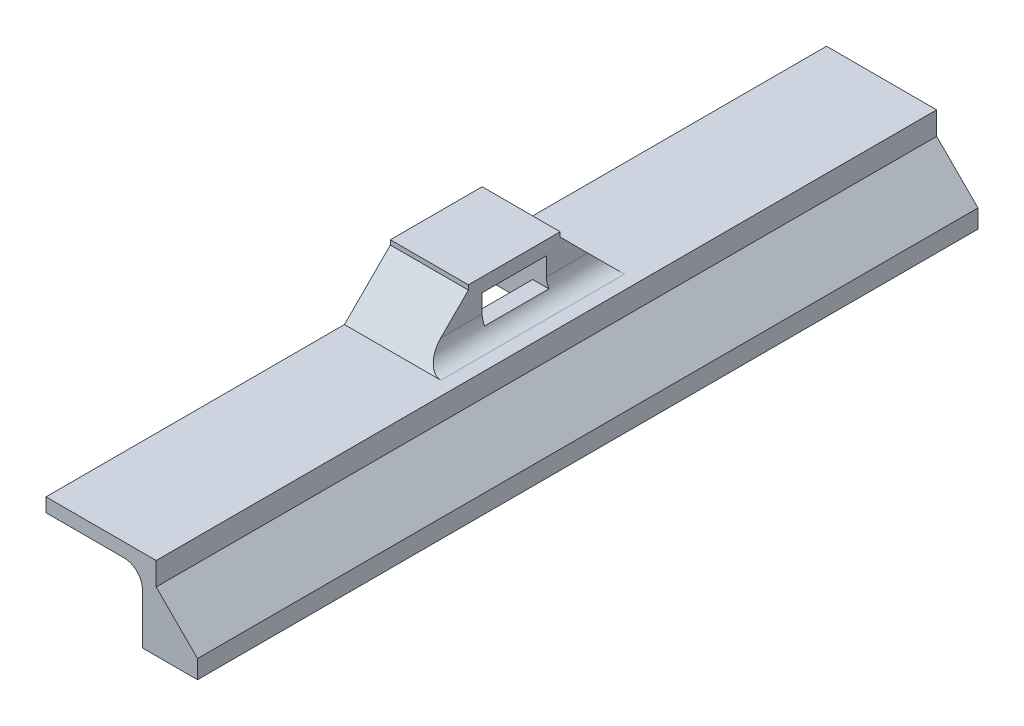
from build123d import *

# Parameters (mm, degrees)
SKETCH_1_W          = 6
SKETCH_1_H          = 85
EXTRUDE_1_DEPTH     = 1.5
SKETCH_2_W          = 1.5
SKETCH_2_H          = 85
EXTRUDE_2_DEPTH     = 6
EXTRUDE_3_DEPTH     = 1.5
SKETCH_4_W          = 7
SKETCH_4_H          = 7
EXTRUDE_4_DEPTH     = 5.5
SKETCH_5_W          = 7
SKETCH_5_H          = 7
CUT_EXTRUDE_1_DEPTH = 4
SKETCH_6_W          = 7
SKETCH_6_H          = 3
CUT_EXTRUDE_2_DEPTH = 4
CHAMFER_1_SIZE      = 5
CHAMFER_2_SIZE      = 5
FILLET_1_R          = 2
FILLET_2_R          = 2


with BuildPart() as part:
    # Эскиз1 → Бобышка-Вытянуть1 (new body)
    with BuildSketch(Plane(origin=(0, 0, 0), x_dir=(1, 0, 0), z_dir=(0, 1, 0))):
        Rectangle(SKETCH_1_W, SKETCH_1_H)
    extrude(amount=EXTRUDE_1_DEPTH)

    # Эскиз2 → Бобышка-Вытянуть2 (add)
    with BuildSketch(Plane(origin=(0, 1.5, 0), x_dir=(1, 0, 0), z_dir=(0, 1, 0))):
        with Locations((-2.25, 0)):
            Rectangle(SKETCH_2_W, SKETCH_2_H)
    extrude(amount=EXTRUDE_2_DEPTH)

    # Эскиз3 → Бобышка-Вытянуть3 (add)
    with BuildSketch(Plane(origin=(0, 7.5, 0), x_dir=(1, 0, 0), z_dir=(0, 1, 0))):
        Polygon((-1.5, -42.5), (-13.5, -42.5), (-13.5, -3.5), (-6.5, -3.5), (-6.5, 3.5), (-13.5, 3.5), (-13.5, 42.5), (-1.5, 42.5), align=None)
    extrude(amount=EXTRUDE_3_DEPTH)

    # Эскиз4 → Бобышка-Вытянуть4 (add)
    with BuildSketch(Plane(origin=(0, 9, 0), x_dir=(1, 0, 0), z_dir=(0, 1, 0))):
        Polygon((-13.5, -3.5), (-13.5, -5), (-5, -5), (-5, 5), (-13.5, 5), (-13.5, 3.5), (-6.5, 3.5), (-6.5, -3.5), align=None)
        with Locations((-10, 0)):
            Rectangle(SKETCH_4_W, SKETCH_4_H)
    extrude(amount=EXTRUDE_4_DEPTH)

    # Эскиз5 → Вырез-Вытянуть1 (cut)
    with BuildSketch(Plane.XZ.offset(-9)):
        with Locations((-10, 0)):
            Rectangle(SKETCH_5_W, SKETCH_5_H)
    extrude(amount=-CUT_EXTRUDE_1_DEPTH, mode=Mode.SUBTRACT)

    # Эскиз6 → Вырез-Вытянуть2 (cut)
    with BuildSketch(Plane(origin=(-5, 0, 0), x_dir=(0, 0, -1), z_dir=(1, 0, 0))):
        with Locations((0, 11.5)):
            Rectangle(SKETCH_6_W, SKETCH_6_H)
    extrude(amount=-CUT_EXTRUDE_2_DEPTH, mode=Mode.SUBTRACT)

    # Фаска1
    # the kernel refuses this chamfer: 5 mm, written as the material it adds along each edge
    with BuildSketch(Plane(origin=(-1.5, 1.5, 42.5), x_dir=(-0.02749587661058636, 0.9996219169112968, 0), z_dir=(0, 0, -1))) as chamfer_1_piece_1_section:
        Polygon((CHAMFER_1_SIZE * 0.999621916911, CHAMFER_1_SIZE * 0.0274958766106), (-CHAMFER_1_SIZE * 0.0274958766106, CHAMFER_1_SIZE * 0.999621916911), (0, 0), align=None)
    chamfer_1_piece_1 = extrude(amount=85, mode=Mode.PRIVATE)
    chamfer_1_piece_1 = split(chamfer_1_piece_1, bisect_by=Plane(origin=(3, 3.179503735, 0), z_dir=(-1, 0, 0)), keep=Keep.TOP, mode=Mode.PRIVATE)
    add(chamfer_1_piece_1)

    # Фаска2
    chamfer_2_edges = [part.edges().sort_by_distance(p)[0] for p in [
        (-9.25, 9, 5),
        (-9.25, 9, -5),
    ]]
    chamfer(chamfer_2_edges, length=CHAMFER_2_SIZE)

    # Скругление1
    # the kernel refuses this fillet: 2 mm, written as the material it adds along each edge
    with BuildSketch(Plane(origin=(-5, 9, -15), x_dir=(1, 0, 0), z_dir=(0, 0, 1))) as fillet_1_piece_1_section:
        with BuildLine():
            CenterArc((FILLET_1_R, FILLET_1_R), FILLET_1_R, 180, 90)
            Line((0, FILLET_1_R), (0, 0))
            Line((0, 0), (FILLET_1_R, 0))
        make_face()
    fillet_1_piece_1 = extrude(amount=30, mode=Mode.PRIVATE)
    fillet_1_piece_1 = split(fillet_1_piece_1, bisect_by=Plane(origin=(-4.478955551, 10.861954239, -8.138045761), z_dir=(0, -0.7071067811865476, 0.7071067811865475)), keep=Keep.TOP, mode=Mode.PRIVATE)
    fillet_1_piece_1 = split(fillet_1_piece_1, bisect_by=Plane(origin=(-4.478955551, 10, -6.592030507), z_dir=(0, -1, 0)), keep=Keep.TOP, mode=Mode.PRIVATE)
    fillet_1_piece_1 = split(fillet_1_piece_1, bisect_by=Plane(origin=(-4.478955551, 9.315938986, -3.5), z_dir=(0, 0, -1)), keep=Keep.TOP, mode=Mode.PRIVATE)
    add(fillet_1_piece_1)
    with BuildSketch(Plane(origin=(-5, 9, -15), x_dir=(1, 0, 0), z_dir=(0, 0, 1))) as fillet_1_piece_2_section:
        with BuildLine():
            CenterArc((FILLET_1_R, FILLET_1_R), FILLET_1_R, 180, 90)
            Line((0, FILLET_1_R), (0, 0))
            Line((0, 0), (FILLET_1_R, 0))
        make_face()
    fillet_1_piece_2 = extrude(amount=30, mode=Mode.PRIVATE)
    fillet_1_piece_2 = split(fillet_1_piece_2, bisect_by=Plane(origin=(-4.950049331, 11.610374757, -7.389625243), z_dir=(0, -0.7071067811865476, 0.7071067811865475)), keep=Keep.TOP, mode=Mode.PRIVATE)
    fillet_1_piece_2 = split(fillet_1_piece_2, bisect_by=Plane(origin=(-4.950049331, 10, -6.093083495), z_dir=(0, 1, 0)), keep=Keep.TOP, mode=Mode.PRIVATE)
    fillet_1_piece_2 = split(fillet_1_piece_2, bisect_by=Plane(origin=(-4.950049331, 10.313833009, -3.5), z_dir=(0, 0, -1)), keep=Keep.TOP, mode=Mode.PRIVATE)
    add(fillet_1_piece_2)
    with BuildSketch(Plane(origin=(-5, 9, -15), x_dir=(1, 0, 0), z_dir=(0, 0, 1))) as fillet_1_piece_3_section:
        with BuildLine():
            CenterArc((FILLET_1_R, FILLET_1_R), FILLET_1_R, 180, 90)
            Line((0, FILLET_1_R), (0, 0))
            Line((0, 0), (FILLET_1_R, 0))
        make_face()
    fillet_1_piece_3 = extrude(amount=30, mode=Mode.PRIVATE)
    fillet_1_piece_3 = split(fillet_1_piece_3, bisect_by=Plane(origin=(-4.48975988, 9.328783529, 3.5), z_dir=(0, 0, -1)), keep=Keep.TOP, mode=Mode.PRIVATE)
    fillet_1_piece_3 = split(fillet_1_piece_3, bisect_by=Plane(origin=(-4.48975988, 10, 0), z_dir=(0, -1, 0)), keep=Keep.TOP, mode=Mode.PRIVATE)
    fillet_1_piece_3 = split(fillet_1_piece_3, bisect_by=Plane(origin=(-4.48975988, 9.328783529, -3.5), z_dir=(0, 0, 1)), keep=Keep.TOP, mode=Mode.PRIVATE)
    add(fillet_1_piece_3)
    with BuildSketch(Plane(origin=(-5, 9, -15), x_dir=(1, 0, 0), z_dir=(0, 0, 1))) as fillet_1_piece_4_section:
        with BuildLine():
            CenterArc((FILLET_1_R, FILLET_1_R), FILLET_1_R, 180, 90)
            Line((0, FILLET_1_R), (0, 0))
            Line((0, 0), (FILLET_1_R, 0))
        make_face()
    fillet_1_piece_4 = extrude(amount=30, mode=Mode.PRIVATE)
    fillet_1_piece_4 = split(fillet_1_piece_4, bisect_by=Plane(origin=(-4.478955551, 10.861954239, 8.138045761), z_dir=(0, -0.7071067811865475, -0.7071067811865476)), keep=Keep.TOP, mode=Mode.PRIVATE)
    fillet_1_piece_4 = split(fillet_1_piece_4, bisect_by=Plane(origin=(-4.478955551, 9.315938986, 3.5), z_dir=(0, 0, 1)), keep=Keep.TOP, mode=Mode.PRIVATE)
    fillet_1_piece_4 = split(fillet_1_piece_4, bisect_by=Plane(origin=(-4.478955551, 10, 6.592030507), z_dir=(0, -1, 0)), keep=Keep.TOP, mode=Mode.PRIVATE)
    add(fillet_1_piece_4)
    with BuildSketch(Plane(origin=(-5, 9, -15), x_dir=(1, 0, 0), z_dir=(0, 0, 1))) as fillet_1_piece_5_section:
        with BuildLine():
            CenterArc((FILLET_1_R, FILLET_1_R), FILLET_1_R, 180, 90)
            Line((0, FILLET_1_R), (0, 0))
            Line((0, 0), (FILLET_1_R, 0))
        make_face()
    fillet_1_piece_5 = extrude(amount=30, mode=Mode.PRIVATE)
    fillet_1_piece_5 = split(fillet_1_piece_5, bisect_by=Plane(origin=(-4.950049331, 11.610374757, 7.389625243), z_dir=(0, -0.7071067811865475, -0.7071067811865476)), keep=Keep.TOP, mode=Mode.PRIVATE)
    fillet_1_piece_5 = split(fillet_1_piece_5, bisect_by=Plane(origin=(-4.950049331, 10.313833009, 3.5), z_dir=(0, 0, 1)), keep=Keep.TOP, mode=Mode.PRIVATE)
    fillet_1_piece_5 = split(fillet_1_piece_5, bisect_by=Plane(origin=(-4.950049331, 10, 6.093083495), z_dir=(0, 1, 0)), keep=Keep.TOP, mode=Mode.PRIVATE)
    add(fillet_1_piece_5)

    # Скругление2
    fillet_2_edges = [part.edges().sort_by_distance(p)[0] for p in [
        (-3, 7.5, 0),
    ]]
    fillet(fillet_2_edges, radius=FILLET_2_R)


solid = part.part
